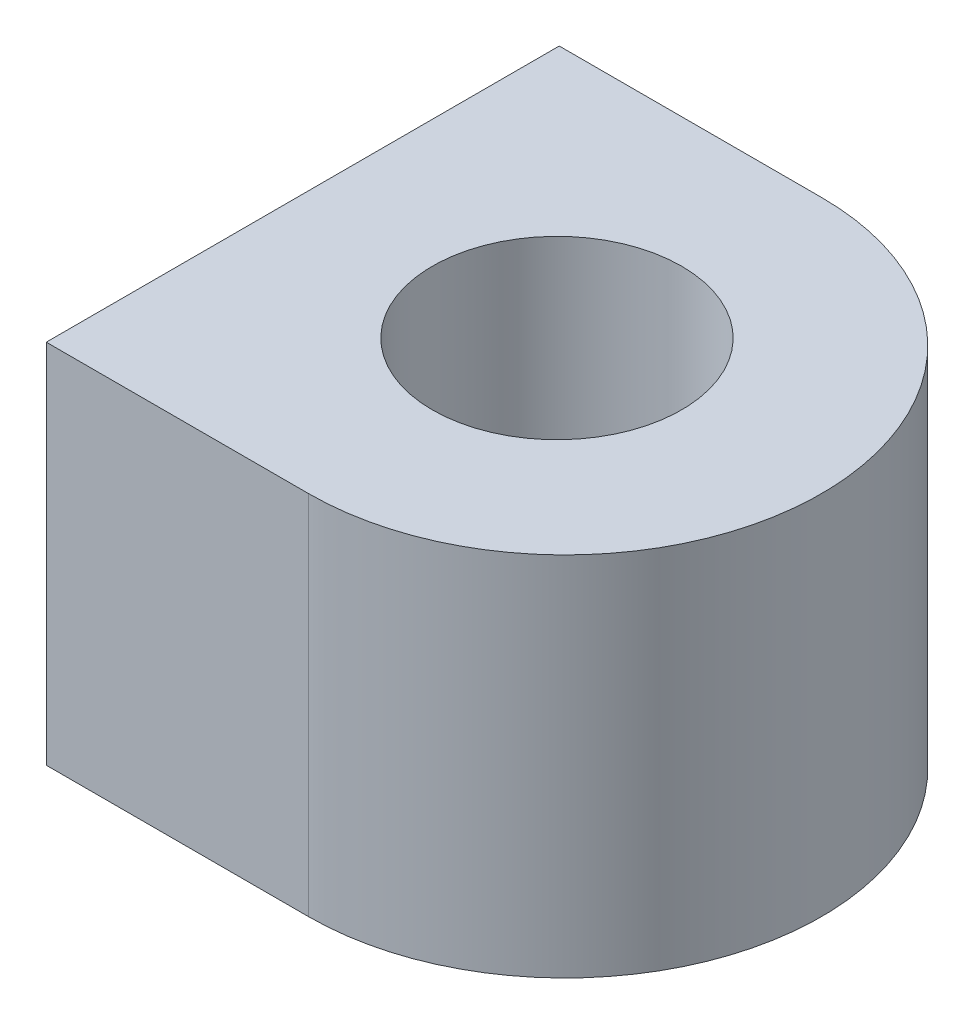
from build123d import *

# Parameters (mm, degrees)
SKETCH1_R           = 1.7
BOSS_EXTRUDE2_DEPTH = 5


with BuildPart() as part:
    # Sketch1 → Boss-Extrude2 (new body)
    with BuildSketch(Plane(origin=(0, 0, 0), x_dir=(1, 0, 0), z_dir=(0, 1, 0))):
        with BuildLine():
            Line((-3.435794878, -0.033363683), (-3.435794878, 3.466636317))
            Line((-3.435794878, 3.466636317), (0.143666226, 3.466636317))
            ThreePointArc((0.143666226, 3.466636317), (3.643666226, -0.033363683), (0.143666226, -3.533363683))
            Line((0.143666226, -3.533363683), (-3.435794878, -3.533363683))
            Line((-3.435794878, -3.533363683), (-3.435794878, -0.033363683))
        make_face()
        Circle(SKETCH1_R, mode=Mode.SUBTRACT)
    extrude(amount=BOSS_EXTRUDE2_DEPTH)


solid = part.part
